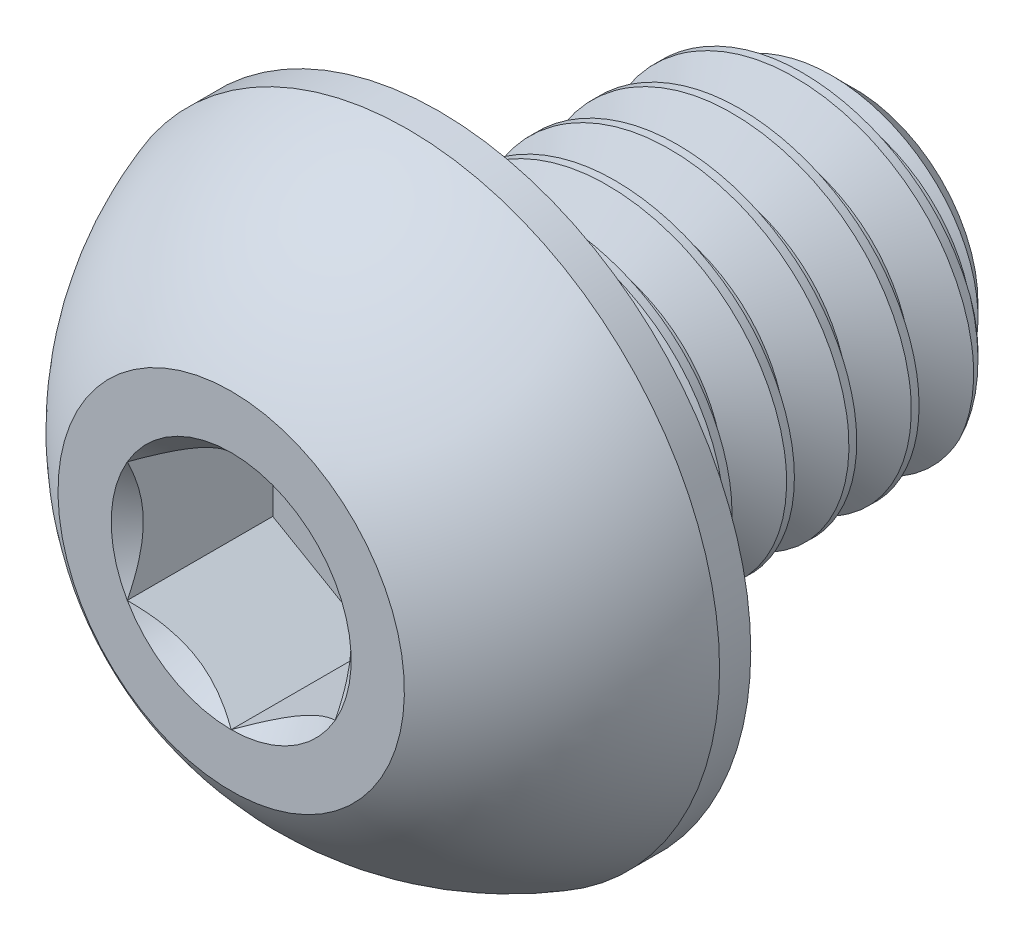
from build123d import *

# Parameters (mm, degrees)
CUT_EXTRUDE1_DEPTH = 1.05
CUT_SWEEP1_PITCH   = 0.45


# Read off the part's stored shape, not the designer's step: Split1
with BuildPart() as part:
    # Sketch2 → Revolve1 (revolve)
    with BuildSketch(Plane(origin=(0, 0, 0), x_dir=(0, 0, -1), z_dir=(1, 0, 0)), mode=Mode.PRIVATE) as revolve1_sk:
        with BuildLine():
            Line((-2.25, 0), (2.25, 0))
            Line((2.25, 0), (2.25, 0.89))
            Line((2.25, 0.89), (1.89, 1.25))
            Line((1.89, 1.25), (-0.75, 1.25))
            Line((-0.75, 1.25), (-0.75, 2.25))
            Line((-0.75, 2.25), (-0.975, 2.25))
            ThreePointArc((-0.975, 2.25), (-1.700735294, 1.8625), (-2.25, 1.25))
            Line((-2.25, 1.25), (-2.25, 0))
        make_face()
    revolve(revolve1_sk.sketch.rotate(Axis((0, 0, 2.25), (0, 0, -1)), 180), axis=Axis((0, 0, 2.25), (0, 0, -1)))

    # Sketch3 → Cut-Extrude1 (cut)
    with BuildSketch(Plane.XY.offset(2.25)):
        Polygon((0, 0.866025404), (-0.75, 0.433012702), (-0.75, -0.433012702), (0, -0.866025404), (0.75, -0.433012702), (0.75, 0.433012702), align=None)
    extrude(amount=-CUT_EXTRUDE1_DEPTH, mode=Mode.SUBTRACT)

    # Cut-Extrude2 cone 1 section (through the dimple's axis) → Cut-Extrude2 (revolve, cut)
    with BuildSketch(Plane(origin=(0, 0, 2.25), x_dir=(0, -1, 0), z_dir=(1, 0, 0))):
        Polygon((0, 0), (0.866025404, 0), (0, 0.866025404), align=None)
    revolve(axis=Axis((0, 0, 2.25), (0, 0, -1)), mode=Mode.SUBTRACT)


with BuildPart() as body_2:
    # Split1: the piece on the far side of the plane
    add(part.part)
    split(bisect_by=Plane.XY.offset(0.75), keep=Keep.BOTTOM)

    # Cut-Sweep1: the profile of Sketch6 screwed along a right-hand helix of 7.666667 turns, 6 arcs to a turn; built about Z, then put on its axis
    cut_sweep1_z = Axis((0, 0, 0), (0, 0, 1))
    cut_sweep1_corners = [(0.957716426, 0, -0.16875), (0.957716426, 0, -0.225), (1.274356964, 0, -0.4078125), (1.274356964, 0, 0.0140625)]
    with BuildLine(mode=Mode.PRIVATE) as cut_sweep1_profile:
        Line(cut_sweep1_corners[0], cut_sweep1_corners[1])
        Line(cut_sweep1_corners[1], cut_sweep1_corners[2])
        Line(cut_sweep1_corners[2], cut_sweep1_corners[3])
        Line(cut_sweep1_corners[3], cut_sweep1_corners[0])
    cut_sweep1_cap = Face(cut_sweep1_profile.wire())
    cut_sweep1_turn_angles = [0, 30, 60, 90, 120, 150, 180, 210, 240, 270, 300, 330, 360]
    cut_sweep1_turn_weights = [1, 0.8660254037844387, 1, 0.8660254037844387, 1, 0.8660254037844387, 1, 0.8660254037844387, 1, 0.8660254037844387, 1, 0.8660254037844387, 1]
    cut_sweep1_turn_rails = [Edge.make_bspline([Vector(p[0], p[1], 0).rotate(cut_sweep1_z, cut_sweep1_turn_angles[k]) / cut_sweep1_turn_weights[k] + Vector(0, 0, p[2] + CUT_SWEEP1_PITCH * cut_sweep1_turn_angles[k] / 360) for k in range(13)], [0, 0, 0, 1, 1, 2, 2, 3, 3, 4, 4, 5, 5, 6, 6, 6], 2, cut_sweep1_turn_weights) for p in cut_sweep1_corners]
    cut_sweep1_turn_sides = [Face.make_surface_from_curves(cut_sweep1_turn_rails[p[0]], cut_sweep1_turn_rails[p[1]]) for p in [(0, 1), (1, 2), (2, 3), (3, 0)]]
    cut_sweep1_last_angles = [2520, 2550, 2580, 2610, 2640, 2670, 2700, 2730, 2760]
    cut_sweep1_last_weights = [1, 0.8660254037844387, 1, 0.8660254037844387, 1, 0.8660254037844387, 1, 0.8660254037844228, 1]
    cut_sweep1_last_rails = [Edge.make_bspline([Vector(p[0], p[1], 0).rotate(cut_sweep1_z, cut_sweep1_last_angles[k]) / cut_sweep1_last_weights[k] + Vector(0, 0, p[2] + CUT_SWEEP1_PITCH * cut_sweep1_last_angles[k] / 360) for k in range(9)], [0, 0, 0, 1, 1, 2, 2, 3, 3, 4, 4, 4], 2, cut_sweep1_last_weights) for p in cut_sweep1_corners]
    cut_sweep1_last_sides = [Face.make_surface_from_curves(cut_sweep1_last_rails[p[0]], cut_sweep1_last_rails[p[1]]) for p in [(0, 1), (1, 2), (2, 3), (3, 0)]]
    cut_sweep1 = Plane(origin=(0, 0, -2.25), x_dir=(0, 1, 0), z_dir=(0, 0, 1)) * Solid(Shell([*[p.moved(Location((0, 0, CUT_SWEEP1_PITCH * i))) for i in range(7) for p in cut_sweep1_turn_sides], *cut_sweep1_last_sides, cut_sweep1_cap, cut_sweep1_cap.rotate(cut_sweep1_z, 2760).moved(Location((0, 0, CUT_SWEEP1_PITCH * 2760 / 360)))]))
    add(cut_sweep1, mode=Mode.SUBTRACT)


with BuildPart() as part_1:
    add(part.part)

    # Split1
    split(bisect_by=Plane.XY.offset(0.75), keep=Keep.TOP)

    add(body_2.part)  # Boss-Extrude1 merges body 2
    # Boss-Extrude1 cone 1 section (through the dimple's axis) → Boss-Extrude1 (revolve)
    with BuildSketch(Plane(origin=(0, 0, 0.75), x_dir=(0, -1, 0), z_dir=(1, 0, 0))):
        Polygon((0, 0), (1.25, 0), (0, 2.165063509), align=None)
    revolve(axis=Axis((0, 0, 0.75), (0, 0, -1)))


solid = part_1.part
